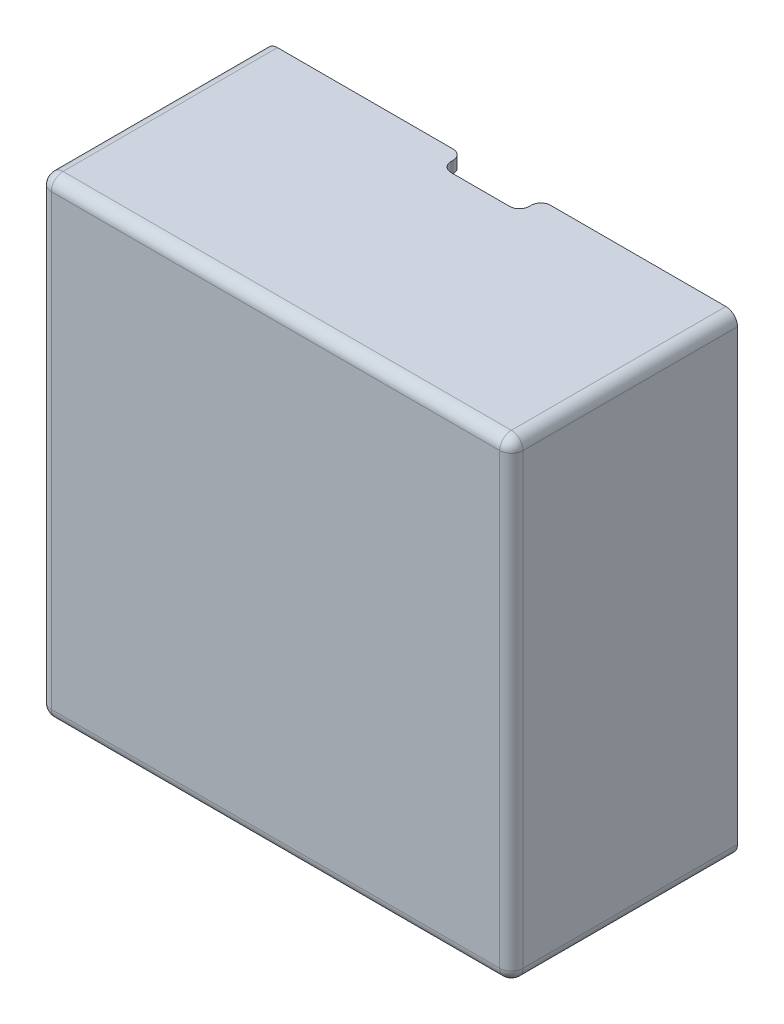
from build123d import *

# Parameters (mm, degrees)
SKETCH1_W           = 121
SKETCH1_H           = 121
SKETCH1_W_2         = 115
SKETCH1_H_2         = 115
BOSS_EXTRUDE1_DEPTH = 55
SKETCH2_W           = 121
SKETCH2_H           = 121
BOSS_EXTRUDE2_DEPTH = 3
FILLET1_R           = 3
FILLET2_R           = 3
SKETCH3_W           = 20
SKETCH3_H           = 10
CUT_EXTRUDE1_DEPTH  = 177
FILLET3_R           = 2.5
FILLET4_R           = 2.5


with BuildPart() as part:
    # Sketch1 → Boss-Extrude1 (new body)
    with BuildSketch(Plane.XY):
        Rectangle(SKETCH1_W, SKETCH1_H)
        Rectangle(SKETCH1_W_2, SKETCH1_H_2, mode=Mode.SUBTRACT)
    extrude(amount=BOSS_EXTRUDE1_DEPTH)

    # Sketch2 → Boss-Extrude2 (add)
    with BuildSketch(Plane.XY.offset(55)):
        Rectangle(SKETCH2_W, SKETCH2_H)
    extrude(amount=BOSS_EXTRUDE2_DEPTH)

    # Fillet1
    fillet1_edges = [part.edges().sort_by_distance(p)[0] for p in [
        (0, -57.5, 55),
        (57.5, 0, 55),
        (0, 57.5, 55),
        (-57.5, 0, 55),
        (-57.5, 57.5, 27.5),
        (-57.5, -57.5, 27.5),
        (57.5, -57.5, 27.5),
        (57.5, 57.5, 27.5),
    ]]
    fillet(fillet1_edges, radius=FILLET1_R)

    # Fillet2
    fillet2_edges = [part.edges().sort_by_distance(p)[0] for p in [
        (0, 60.5, 58),
        (60.5, 0, 58),
        (0, -60.5, 58),
        (-60.5, 0, 58),
        (60.5, -60.5, 29),
        (-60.5, -60.5, 29),
        (-60.5, 60.5, 29),
        (60.5, 60.5, 29),
    ]]
    fillet(fillet2_edges, radius=FILLET2_R)

    # Sketch3 → Cut-Extrude1 (cut)
    with BuildSketch(Plane.XZ.offset(60.5)):
        with Locations((0.054250772, 0.496011987)):
            Rectangle(SKETCH3_W, SKETCH3_H)
    extrude(amount=-CUT_EXTRUDE1_DEPTH, mode=Mode.SUBTRACT)

    # Fillet3
    fillet3_edges = [part.edges().sort_by_distance(p)[0] for p in [
        (-9.945749228, -59, 5.496011987),
        (10.054250772, -59, 5.496011987),
        (10.054250772, -59, 0),
        (-9.945749228, -59, 0),
    ]]
    fillet(fillet3_edges, radius=FILLET3_R)

    # Fillet4
    fillet4_edges = [part.edges().sort_by_distance(p)[0] for p in [
        (-9.945749228, 59, 5.496011987),
        (-9.945749228, 59, 0),
        (10.054250772, 59, 5.496011987),
        (10.054250772, 59, 0),
    ]]
    fillet(fillet4_edges, radius=FILLET4_R)


solid = part.part
